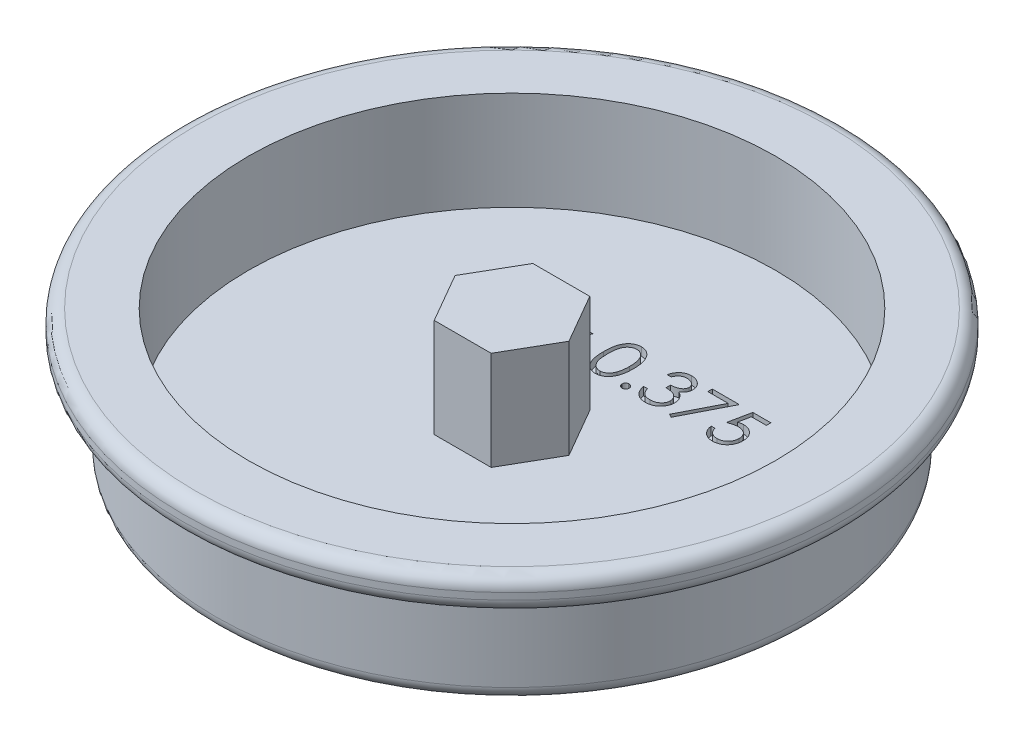
from build123d import *

# Parameters (mm, degrees)
BOSS_EXTRUDE1_DEPTH = 9.525
CUT_EXTRUDE1_DEPTH  = 0.79375


with BuildPart() as part:
    # Sketch1 → Revolve1 (revolve)
    with BuildSketch(Plane.XY):
        with BuildLine():
            Line((0, 0), (27.305, 0))
            ThreePointArc((27.305, 0), (28.203025612, 0.371974388), (28.575, 1.27))
            Line((28.575, 1.27), (28.575, 8.255))
            ThreePointArc((28.575, 8.255), (28.946974388, 9.153025612), (29.845, 9.525))
            Line((29.845, 9.525), (30.48, 9.525))
            ThreePointArc((30.48, 9.525), (31.378025612, 9.896974388), (31.75, 10.795))
            Line((31.75, 10.795), (31.75, 11.43))
            ThreePointArc((31.75, 11.43), (31.378025612, 12.328025612), (30.48, 12.7))
            Line((30.48, 12.7), (25.4, 12.7))
            Line((25.4, 12.7), (25.4, 3.175))
            Line((25.4, 3.175), (0, 3.175))
            Line((0, 3.175), (0, 0))
        make_face()
    revolve(axis=Axis((0, 3.175, 0), (0, -1, 0)))

    # Sketch2 → Boss-Extrude1 (add)
    with BuildSketch(Plane(origin=(0, 3.175, 0), x_dir=(1, 0, 0), z_dir=(0, 1, 0))):
        Polygon((2.742298309, 4.7498), (-2.742298309, 4.7498), (-5.484596617, 0), (-2.742298309, -4.7498), (2.742298309, -4.7498), (5.484596617, 0), align=None)
    extrude(amount=BOSS_EXTRUDE1_DEPTH)

    # Sketch3 → Cut-Extrude1 (cut)
    # profile 1 of 7: a face of its own
    with BuildSketch(Plane(origin=(0, 3.175, 0), x_dir=(1, 0, 0), z_dir=(0, 1, 0))):
        with BuildLine():
            Line((-10.301940322, 11.144696079), (-10.681854852, 11.144696079))
            add(Edge.make_bspline(
                [(-10.681854852, 11.144696079), (-10.679378771, 11.195098009), (-10.674515815, 11.29408606), (-10.651742551, 11.438411166), (-10.619156919, 11.576363161), (-10.573084398, 11.70683439), (-10.515866329, 11.830978471), (-10.44725001, 11.9483023), (-10.365977448, 12.058358309), (-10.273803589, 12.160126243), (-10.173692949, 12.253486448), (-10.065675289, 12.334107551), (-9.952167494, 12.402225116), (-9.833513935, 12.459170999), (-9.70837592, 12.501915384), (-9.577889035, 12.533631081), (-9.441479985, 12.552712947), (-9.348540148, 12.55476404), (-9.301272587, 12.55580719)],
                knots=[0, 0, 0, 0, 1.10065271, 2.161652631, 3.183658789, 4.190468796, 5.17591951, 6.163126047, 7.15150782, 8.156236427, 9.156009102, 10.134482811, 11.092018607, 12.041330605, 13.001268258, 13.972401359, 14.968799086, 16, 16, 16, 16], degree=3))
            add(Edge.make_bspline(
                [(-9.301272587, 12.55580719), (-9.254853392, 12.554720485), (-9.163641333, 12.55258515), (-9.030518706, 12.534247524), (-8.903788074, 12.505526665), (-8.783697156, 12.465230876), (-8.671204107, 12.411063045), (-8.565463853, 12.345993641), (-8.465217539, 12.270737274), (-8.374978858, 12.182135042), (-8.292116705, 12.087547396), (-8.22063112, 11.986566789), (-8.159413294, 11.882270415), (-8.108386291, 11.773862971), (-8.070823151, 11.660323727), (-8.042304747, 11.543305682), (-8.026184923, 11.421597577), (-8.023710934, 11.339221076), (-8.022453142, 11.297340309)],
                knots=[0, 0, 0, 0, 1.111607364, 2.184268762, 3.212621178, 4.221274766, 5.211760367, 6.196651075, 7.1921475, 8.207485113, 9.220403448, 10.201281604, 11.166441695, 12.114753415, 13.065576456, 14.026450734, 14.996634279, 16, 16, 16, 16], degree=3))
            add(Edge.make_bspline(
                [(-8.022453142, 11.297340309), (-8.024501184, 11.238378643), (-8.028561327, 11.121490003), (-8.063292049, 10.949719646), (-8.117534972, 10.783297129), (-8.182846061, 10.649357726), (-8.248731779, 10.54142769), (-8.308104288, 10.452565542), (-8.377609345, 10.356885595), (-8.458258576, 10.254708244), (-8.548383669, 10.145233149), (-8.648800952, 10.028526444), (-8.760226497, 9.905793923), (-8.838432494, 9.821967148), (-8.878956881, 9.778530213)],
                knots=[0, 0, 0, 0, 1.184426356, 2.348067706, 3.509069118, 4.696110526, 5.333549288, 6.050745305, 6.844228056, 7.710549037, 8.667450064, 9.695053472, 10.805634456, 12, 12, 12, 12], degree=3))
            Line((-8.878956881, 9.778530213), (-9.938138238, 8.648114882))
            Line((-9.938138238, 8.648114882), (-7.968179638, 8.648114882))
            Line((-7.968179638, 8.648114882), (-7.968179638, 8.213926848))
            Line((-7.968179638, 8.213926848), (-10.844675364, 8.213926848))
            Line((-10.844675364, 8.213926848), (-9.20290186, 9.965943408))
            add(Edge.make_bspline(
                [(-9.20290186, 9.965943408), (-9.162929654, 10.007669931), (-9.086151227, 10.087818042), (-8.977557063, 10.204830956), (-8.880022286, 10.313385162), (-8.792915535, 10.413275559), (-8.718126438, 10.505963265), (-8.651757167, 10.588446382), (-8.598579738, 10.664349384), (-8.540866831, 10.752330889), (-8.48496992, 10.859751501), (-8.43693688, 10.991025582), (-8.407648444, 11.126162354), (-8.404134976, 11.217483866), (-8.402367672, 11.263419369)],
                knots=[0, 0, 0, 0, 1.329631726, 2.553950428, 3.673215718, 4.687767853, 5.603093632, 6.413772471, 7.123043292, 7.734684054, 8.834405432, 9.900288307, 10.943827018, 12, 12, 12, 12], degree=3))
            add(Edge.make_bspline(
                [(-8.402367672, 11.263419369), (-8.403136617, 11.292304489), (-8.404652061, 11.349231514), (-8.41802661, 11.432695622), (-8.438238365, 11.51320735), (-8.467200724, 11.591014346), (-8.505429829, 11.665334325), (-8.551964298, 11.736257754), (-8.605655137, 11.804824407), (-8.66776572, 11.869114586), (-8.735996796, 11.927995663), (-8.80807746, 11.980155271), (-8.884338062, 12.023745434), (-8.964457067, 12.059478997), (-9.048211111, 12.087510173), (-9.135762184, 12.106933407), (-9.226868375, 12.119128411), (-9.289078412, 12.12077841), (-9.320777127, 12.121619155)],
                knots=[0, 0, 0, 0, 0.991446411, 1.95395049, 2.89581595, 3.838931463, 4.798493298, 5.75982156, 6.748411868, 7.785213223, 8.824556874, 9.840280684, 10.836137867, 11.835679398, 12.848801643, 13.863922112, 14.911575587, 16, 16, 16, 16], degree=3))
            add(Edge.make_bspline(
                [(-9.320777127, 12.121619155), (-9.353882801, 12.120754307), (-9.418896878, 12.119055887), (-9.514351328, 12.107175141), (-9.605411268, 12.086678744), (-9.69230576, 12.058646004), (-9.775181831, 12.023015188), (-9.853636436, 11.978635649), (-9.927493455, 11.925678472), (-9.996891726, 11.865637037), (-10.060831967, 11.798789557), (-10.11701057, 11.72427084), (-10.166097901, 11.64344149), (-10.208926212, 11.556519605), (-10.243706904, 11.462716462), (-10.270283952, 11.362365047), (-10.291313757, 11.255901091), (-10.298339301, 11.182380083), (-10.301940322, 11.144696079)],
                knots=[0, 0, 0, 0, 1.031018746, 2.02475058, 2.990194455, 3.934040569, 4.864654155, 5.795059489, 6.735614925, 7.690564532, 8.649604399, 9.611025574, 10.590972636, 11.591080095, 12.624614302, 13.701020113, 14.821632451, 16, 16, 16, 16], degree=3))
        make_face()
    # profile 2 of 7: a face of its own
    with BuildSketch(Plane(origin=(0, 3.175, 0), x_dir=(1, 0, 0), z_dir=(0, 1, 0))):
        Polygon((-5.96005998, 11.307516591), (-5.508063452, 11.307516591), (-4.711769381, 10.19151766), (-3.915475311, 11.307516591), (-3.463478783, 11.307516591), (-4.485347106, 9.875204893), (-3.30065827, 8.213926848), (-3.752654798, 8.213926848), (-4.711769381, 9.558044102), (-5.670883965, 8.213926848), (-6.122880493, 8.213926848), (-4.937343634, 9.875204893), align=None)
    # profile 3 of 7: a face of its own
    with BuildSketch(Plane(origin=(0, 3.175, 0), x_dir=(1, 0, 0), z_dir=(0, 1, 0))):
        with BuildLine():
            add(Edge.make_bspline(
                [(-1.509632629, 10.328897467), (-1.509235884, 10.396748594), (-1.508465199, 10.528550384), (-1.499891585, 10.720604189), (-1.485649028, 10.900775205), (-1.466130492, 11.069072057), (-1.442377887, 11.225538191), (-1.410669632, 11.369755469), (-1.374610337, 11.502391374), (-1.332818331, 11.623878423), (-1.285661672, 11.735853359), (-1.234336424, 11.840386698), (-1.176805672, 11.937320273), (-1.116357406, 12.028201219), (-1.05054471, 12.111541879), (-0.981240459, 12.188519194), (-0.905739713, 12.257354102), (-0.826609027, 12.320063439), (-0.74313197, 12.375035657), (-0.657687983, 12.423456208), (-0.56968895, 12.464821762), (-0.478894615, 12.497346384), (-0.386121045, 12.524210932), (-0.291043926, 12.542582326), (-0.193506276, 12.554141634), (-0.12767016, 12.555246737), (-0.094281401, 12.55580719)],
                knots=[0, 0, 0, 0, 1.646270934, 3.197905019, 4.663502075, 6.030701355, 7.308322542, 8.50163776, 9.611534131, 10.641858119, 11.616356847, 12.558055219, 13.465016945, 14.349605745, 15.204443733, 16.039544428, 16.859896111, 17.680448484, 18.487036065, 19.28249412, 20.06191084, 20.843045899, 21.620316918, 22.403196591, 23.190181807, 24, 24, 24, 24], degree=3))
            add(Edge.make_bspline(
                [(-0.094281401, 12.55580719), (-0.060613727, 12.555217166), (0.006340684, 12.554043793), (0.105328566, 12.542766263), (0.20202961, 12.524053571), (0.296031549, 12.49753963), (0.388106533, 12.464645812), (0.477534378, 12.423416632), (0.564870563, 12.375424097), (0.648727196, 12.319031408), (0.730024874, 12.256157607), (0.806766696, 12.18508276), (0.878959647, 12.106524528), (0.947509779, 12.021323417), (1.010472263, 11.927845266), (1.070432509, 11.827715914), (1.124101543, 11.719184297), (1.17579015, 11.604061255), (1.220405839, 11.479161401), (1.260642155, 11.345188786), (1.293152907, 11.20056096), (1.320233265, 11.046036739), (1.34121233, 10.881048641), (1.356491811, 10.705950335), (1.364563067, 10.520626625), (1.366083077, 10.393919512), (1.366863097, 10.328897467)],
                knots=[0, 0, 0, 0, 0.810914788, 1.612654377, 2.396697861, 3.181598691, 3.963628158, 4.749916497, 5.551656086, 6.361998678, 7.18212741, 8.025565596, 8.878627764, 9.750805457, 10.657531673, 11.591944965, 12.560506719, 13.57287815, 14.630710178, 15.753379473, 16.941251878, 18.199788006, 19.531962791, 20.947069417, 22.433333509, 24, 24, 24, 24], degree=3))
            add(Edge.make_bspline(
                [(1.366863097, 10.328897467), (1.36607499, 10.264159026), (1.364539396, 10.138018814), (1.356582293, 9.953528968), (1.34090852, 9.779359906), (1.321302154, 9.615093918), (1.294147179, 9.461414703), (1.260758073, 9.317790465), (1.223685778, 9.183600969), (1.177923694, 9.05994553), (1.127836454, 8.945099161), (1.073341121, 8.837854134), (1.014957617, 8.737262522), (0.951350278, 8.644129495), (0.88355234, 8.55779531), (0.810112729, 8.4797839), (0.73310164, 8.408215563), (0.651564718, 8.344532166), (0.566400271, 8.288791498), (0.479364054, 8.238942364), (0.388911771, 8.198746628), (0.297093247, 8.164232817), (0.202595128, 8.137864651), (0.105535208, 8.119632464), (0.006407189, 8.106845562), (-0.060602323, 8.105870105), (-0.094281401, 8.105379839)],
                knots=[0, 0, 0, 0, 1.561518951, 3.042555995, 4.452378317, 5.7783523, 7.031515105, 8.214008947, 9.334062868, 10.386615937, 11.391082383, 12.354592575, 13.286541444, 14.194233754, 15.072674879, 15.931287219, 16.775624067, 17.606195743, 18.42308326, 19.229000347, 20.022332153, 20.807536673, 21.593273796, 22.3848459, 23.188221202, 24, 24, 24, 24], degree=3))
            add(Edge.make_bspline(
                [(-0.094281401, 8.105379839), (-0.127669234, 8.105943907), (-0.193503524, 8.107056139), (-0.291054553, 8.118563224), (-0.385739032, 8.137063499), (-0.478024191, 8.162967392), (-0.5683835, 8.194674861), (-0.655585675, 8.235984554), (-0.740600302, 8.283560047), (-0.823200565, 8.337741176), (-0.901834322, 8.399815974), (-0.976944064, 8.468473732), (-1.046642896, 8.545427763), (-1.111514612, 8.629462965), (-1.173168985, 8.71980622), (-1.229882799, 8.817691014), (-1.282340879, 8.922729219), (-1.330290625, 9.035599454), (-1.372803771, 9.157948748), (-1.410356713, 9.291176802), (-1.44000717, 9.436459524), (-1.465386554, 9.592630053), (-1.485856998, 9.760359474), (-1.49983223, 9.939738844), (-1.50846982, 10.130656382), (-1.509237953, 10.261611252), (-1.509632629, 10.328897467)],
                knots=[0, 0, 0, 0, 0.810891512, 1.598919785, 2.382837074, 3.152667961, 3.926044502, 4.706494248, 5.493654104, 6.291793342, 7.103789334, 7.925228297, 8.761435821, 9.622817696, 10.50288917, 11.416980706, 12.369136599, 13.353924996, 14.394355917, 15.514179734, 16.714354668, 17.994756427, 19.357759367, 20.818452758, 22.365282078, 24, 24, 24, 24], degree=3))
        make_face()
        with BuildLine():
            add(Edge.make_bspline(
                [(-1.129718099, 10.330593514), (-1.129573625, 10.27404985), (-1.12929323, 10.164309701), (-1.121968111, 10.004842137), (-1.111989259, 9.856106597), (-1.099118356, 9.717914224), (-1.080004314, 9.59073278), (-1.058587532, 9.473687545), (-1.032524605, 9.367397934), (-1.001687774, 9.271134582), (-0.966564295, 9.183263804), (-0.928215298, 9.101498525), (-0.887018042, 9.024872849), (-0.840912022, 8.954075056), (-0.790698565, 8.888874267), (-0.737511861, 8.828116461), (-0.679366926, 8.773933445), (-0.598929066, 8.708949535), (-0.492737139, 8.641797821), (-0.358939065, 8.583322074), (-0.221454367, 8.54657377), (-0.128138093, 8.541900465), (-0.081561048, 8.539567873)],
                knots=[0, 0, 0, 0, 1.459021318, 2.831673884, 4.118529203, 5.306027144, 6.411944654, 7.436330062, 8.375795394, 9.233974572, 10.042671642, 10.816086306, 11.563610507, 12.285937304, 12.993564865, 13.685989202, 14.367179055, 15.041617293, 16.353048772, 17.594441528, 18.799311195, 20, 20, 20, 20], degree=3))
            add(Edge.make_bspline(
                [(-0.081561048, 8.539567873), (-0.034682721, 8.541500427), (0.058977146, 8.545361545), (0.195815165, 8.582613351), (0.328657491, 8.638819366), (0.432763552, 8.705279682), (0.511966248, 8.768572042), (0.568713464, 8.822534522), (0.620798037, 8.882957333), (0.670197499, 8.948149814), (0.715505143, 9.019357486), (0.756705319, 9.096237934), (0.794301368, 9.179004654), (0.815720881, 9.236783291), (0.826672125, 9.266324017)],
                knots=[0, 0, 0, 0, 1.353760809, 2.704726607, 4.075137775, 5.516104923, 6.260822281, 7.007110065, 7.778089737, 8.566572457, 9.372053459, 10.217411131, 11.088608312, 12, 12, 12, 12], degree=3))
            add(Edge.make_bspline(
                [(0.826672125, 9.266324017), (0.839434739, 9.30409713), (0.86534832, 9.38079275), (0.898745418, 9.499765929), (0.925046996, 9.624592129), (0.948709353, 9.754525365), (0.964860192, 9.890523861), (0.977859928, 10.03216682), (0.985517045, 10.17956104), (0.98646622, 10.279703553), (0.986948567, 10.330593514)],
                knots=[0, 0, 0, 0, 0.884706709, 1.796334032, 2.740027952, 3.714592787, 4.726048262, 5.777819803, 6.87074269, 8, 8, 8, 8], degree=3))
            add(Edge.make_bspline(
                [(0.986948567, 10.330593514), (0.9862831, 10.381475245), (0.984981305, 10.481010787), (0.980005339, 10.626780396), (0.967155872, 10.765231878), (0.952884557, 10.896961688), (0.931842204, 11.021240626), (0.90915419, 11.13910909), (0.878672724, 11.249106844), (0.846112615, 11.352956052), (0.808846708, 11.449476844), (0.76782482, 11.539119233), (0.72401374, 11.622315996), (0.676428364, 11.698838868), (0.625633585, 11.76903061), (0.57028874, 11.831483882), (0.512589165, 11.88813431), (0.431772188, 11.95279856), (0.325969952, 12.018731754), (0.19431855, 12.079408435), (0.057315008, 12.11425275), (-0.035302407, 12.119165458), (-0.081561048, 12.121619155)],
                knots=[0, 0, 0, 0, 1.31362396, 2.569729283, 3.763502607, 4.902122613, 5.988968491, 7.01645872, 7.998833611, 8.933434873, 9.825090667, 10.667526885, 11.477055099, 12.250526234, 12.991942729, 13.710640831, 14.402115721, 15.076753259, 16.378508321, 17.609869233, 18.806226677, 20, 20, 20, 20], degree=3))
            add(Edge.make_bspline(
                [(-0.081561048, 12.121619155), (-0.128382431, 12.119162072), (-0.222110494, 12.11424343), (-0.36053802, 12.079538257), (-0.493228045, 12.019046383), (-0.5987505, 11.952580181), (-0.679623842, 11.889275747), (-0.736571481, 11.83437975), (-0.789967327, 11.774331423), (-0.839155879, 11.708531012), (-0.885225774, 11.637815758), (-0.927536141, 11.561629347), (-0.965657102, 11.479585697), (-1.000835541, 11.39175439), (-1.031766437, 11.295499343), (-1.057280088, 11.189340655), (-1.080850143, 11.0726677), (-1.097535849, 10.944797438), (-1.112369153, 10.806570453), (-1.121901831, 10.657463601), (-1.129317733, 10.497728589), (-1.129581971, 10.387421035), (-1.129718099, 10.330593514)],
                knots=[0, 0, 0, 0, 1.207732386, 2.417664972, 3.655092373, 4.956220595, 5.625982001, 6.301752483, 6.994047911, 7.697131622, 8.419323945, 9.170223765, 9.943494443, 10.752040957, 11.610060368, 12.549350801, 13.567764191, 14.679664412, 15.874934091, 17.154273443, 18.533957287, 20, 20, 20, 20], degree=3))
        make_face(mode=Mode.SUBTRACT)
    # profile 4 of 7: a face of its own
    with BuildSketch(Plane(origin=(0, 3.175, 0), x_dir=(1, 0, 0), z_dir=(0, 1, 0))):
        with BuildLine():
            add(Edge.make_bspline(
                [(2.425196431, 8.865208899), (2.448770306, 8.863808069), (2.494984133, 8.861061905), (2.561797174, 8.842221547), (2.622266906, 8.808767739), (2.676129716, 8.764181331), (2.720527073, 8.710120862), (2.755173099, 8.65013343), (2.773849339, 8.582761027), (2.776575499, 8.53627942), (2.777974208, 8.512431121)],
                knots=[0, 0, 0, 0, 1.020151414, 1.999887582, 2.974338812, 3.990962822, 5.007586832, 5.987933904, 6.967670073, 8, 8, 8, 8], degree=3))
            add(Edge.make_bspline(
                [(2.777974208, 8.512431121), (2.776528101, 8.489155856), (2.773676398, 8.443257374), (2.75521591, 8.376393129), (2.72026303, 8.316368206), (2.676435943, 8.261574191), (2.62225359, 8.216893329), (2.561654214, 8.18372414), (2.495140978, 8.163534793), (2.448796473, 8.160962986), (2.425196431, 8.159653343)],
                knots=[0, 0, 0, 0, 1.009421747, 1.99056486, 2.972319754, 3.999869655, 5.017953583, 5.993804169, 6.978383603, 8, 8, 8, 8], degree=3))
            add(Edge.make_bspline(
                [(2.425196431, 8.159653343), (2.401579383, 8.160915599), (2.355472719, 8.163379853), (2.289207755, 8.184138676), (2.228239326, 8.216582289), (2.174067522, 8.261657504), (2.129873371, 8.316086249), (2.096459813, 8.376806517), (2.076393632, 8.44306597), (2.073754605, 8.489118157), (2.072418653, 8.512431121)],
                knots=[0, 0, 0, 0, 1.022052826, 1.995314843, 2.982371812, 4.00089066, 5.028879526, 6.005146991, 6.990147033, 8, 8, 8, 8], degree=3))
            add(Edge.make_bspline(
                [(2.072418653, 8.512431121), (2.073703287, 8.536318466), (2.076211378, 8.582955575), (2.096501938, 8.64972021), (2.129614119, 8.710400132), (2.174373025, 8.764098853), (2.228226221, 8.809077781), (2.289060679, 8.841813292), (2.355632313, 8.861214553), (2.401606239, 8.863854359), (2.425196431, 8.865208899)],
                knots=[0, 0, 0, 0, 1.032775665, 2.016367738, 2.991239715, 4.008302682, 5.025365648, 6.011011707, 6.979408107, 8, 8, 8, 8], degree=3))
        make_face()
    # profile 5 of 7: a face of its own
    with BuildSketch(Plane(origin=(0, 3.175, 0), x_dir=(1, 0, 0), z_dir=(0, 1, 0))):
        with BuildLine():
            Line((3.863444294, 11.470337104), (3.483529764, 11.470337104))
            add(Edge.make_bspline(
                [(3.483529764, 11.470337104), (3.493822268, 11.512951632), (3.513943272, 11.59625955), (3.555910813, 11.715285475), (3.601629912, 11.827920591), (3.656529115, 11.932055842), (3.716411132, 12.029784039), (3.785018614, 12.118888599), (3.859186279, 12.201635709), (3.94122217, 12.275069816), (4.027253979, 12.341566688), (4.118493948, 12.398263186), (4.2131064, 12.447036209), (4.311746856, 12.48721687), (4.414708988, 12.517485837), (4.521061961, 12.539446926), (4.63108448, 12.553708559), (4.705769661, 12.555100435), (4.743692691, 12.55580719)],
                knots=[0, 0, 0, 0, 1.162005537, 2.271625781, 3.343758855, 4.383309926, 5.390229558, 6.379919256, 7.361854164, 8.333198761, 9.295911338, 10.242430842, 11.177959212, 12.116337295, 13.062827104, 14.020064771, 14.994644689, 16, 16, 16, 16], degree=3))
            add(Edge.make_bspline(
                [(4.743692691, 12.55580719), (4.798947055, 12.554138978), (4.908250526, 12.550838943), (5.068830592, 12.520704339), (5.223682078, 12.473018702), (5.371110025, 12.407131432), (5.508050415, 12.325866777), (5.629893232, 12.229147524), (5.734986954, 12.118839798), (5.82315444, 11.997001363), (5.89218801, 11.866789461), (5.943092481, 11.732774033), (5.974082514, 11.595272982), (5.978098806, 11.502433225), (5.98011096, 11.455920705)],
                knots=[0, 0, 0, 0, 1.083050992, 2.142477498, 3.193116406, 4.255571735, 5.30263384, 6.308962982, 7.297363603, 8.282367274, 9.249857812, 10.179914175, 11.08814088, 12, 12, 12, 12], degree=3))
            add(Edge.make_bspline(
                [(5.98011096, 11.455920705), (5.978703569, 11.411160105), (5.975949523, 11.323570558), (5.952564946, 11.19569789), (5.913211562, 11.075179003), (5.858698611, 10.961506549), (5.788133117, 10.855401267), (5.702652807, 10.756624427), (5.601654349, 10.664737922), (5.525116967, 10.612100083), (5.485713257, 10.585000566)],
                knots=[0, 0, 0, 0, 1.024540389, 2.004866551, 2.965041327, 3.920577974, 4.882998113, 5.874504559, 6.905732034, 8, 8, 8, 8], degree=3))
            add(Edge.make_bspline(
                [(5.485713257, 10.585000566), (5.530745951, 10.563255539), (5.619968742, 10.520172352), (5.741587001, 10.43568015), (5.851989765, 10.338124378), (5.913559025, 10.261993741), (5.944493973, 10.223742553)],
                knots=[0, 0, 0, 0, 1.015518401, 2.012035669, 3.001164323, 4, 4, 4, 4], degree=3))
            add(Edge.make_bspline(
                [(5.944493973, 10.223742553), (5.964863978, 10.195853653), (6.005270414, 10.140532554), (6.055145774, 10.051588496), (6.100392988, 9.9616586), (6.135650873, 9.868332461), (6.162954502, 9.772691768), (6.182471417, 9.674572299), (6.194595854, 9.573893929), (6.196332189, 9.505782643), (6.197204978, 9.471545705)],
                knots=[0, 0, 0, 0, 1.025084078, 2.033381695, 3.024893161, 4.013698104, 4.991890475, 5.976764909, 6.982997093, 8, 8, 8, 8], degree=3))
            add(Edge.make_bspline(
                [(6.197204978, 9.471545705), (6.195034471, 9.41226728), (6.190703671, 9.293989396), (6.151993982, 9.11924378), (6.091985586, 8.948428173), (6.006766244, 8.785051938), (5.902907448, 8.632191859), (5.779345732, 8.49542337), (5.637485028, 8.377859344), (5.479272482, 8.27963364), (5.30786224, 8.201113867), (5.124527953, 8.146615817), (4.931911221, 8.111121132), (4.799822395, 8.107314919), (4.732668386, 8.105379839)],
                knots=[0, 0, 0, 0, 0.955779014, 1.907060117, 2.875433937, 3.871313158, 4.872415639, 5.851225146, 6.836215519, 7.83643374, 8.849228613, 9.86973379, 10.916971861, 12, 12, 12, 12], degree=3))
            add(Edge.make_bspline(
                [(4.732668386, 8.105379839), (4.687408851, 8.106429964), (4.598353179, 8.108496259), (4.467430091, 8.122621805), (4.342460035, 8.148420954), (4.223274045, 8.183138286), (4.10976624, 8.227154964), (4.002282988, 8.281969008), (3.900163022, 8.346450539), (3.804370005, 8.421360688), (3.714915356, 8.505158118), (3.634176347, 8.599330445), (3.560806883, 8.702136829), (3.496771501, 8.814771382), (3.439153473, 8.935778503), (3.391763173, 9.066707639), (3.350052056, 9.206388313), (3.3306592, 9.303728056), (3.320709251, 9.353670437)],
                knots=[0, 0, 0, 0, 1.048658725, 2.063410685, 3.046034179, 4.001477787, 4.936774919, 5.862367409, 6.792675028, 7.730719943, 8.675894397, 9.627829632, 10.600096036, 11.597688215, 12.626045268, 13.701542398, 14.82072376, 16, 16, 16, 16], degree=3))
            Line((3.320709251, 9.353670437), (3.700623781, 9.353670437))
            add(Edge.make_bspline(
                [(3.700623781, 9.353670437), (3.710521667, 9.321074964), (3.729773914, 9.257673938), (3.762545113, 9.166427092), (3.799881023, 9.08277878), (3.83993387, 9.006115385), (3.881999229, 8.935681907), (3.929067757, 8.87334079), (3.977653295, 8.816353831), (4.014276893, 8.784247491), (4.032200971, 8.76853422)],
                knots=[0, 0, 0, 0, 1.198163088, 2.33053128, 3.407730985, 4.417276592, 5.372219308, 6.28897303, 7.162600585, 8, 8, 8, 8], degree=3))
            add(Edge.make_bspline(
                [(4.032200971, 8.76853422), (4.055903497, 8.75026033), (4.103235384, 8.713768958), (4.180364578, 8.667200322), (4.261481155, 8.626849367), (4.348342713, 8.596026231), (4.439074864, 8.569927536), (4.535144153, 8.552848432), (4.635703016, 8.541130358), (4.704364978, 8.540096298), (4.739452574, 8.539567873)],
                knots=[0, 0, 0, 0, 0.946170439, 1.889420265, 2.845303464, 3.807233317, 4.801018734, 5.828864929, 6.890507805, 8, 8, 8, 8], degree=3))
            add(Edge.make_bspline(
                [(4.739452574, 8.539567873), (4.779068715, 8.540312825), (4.856534659, 8.541769515), (4.969570537, 8.555165846), (5.077106211, 8.574675965), (5.17794775, 8.604808811), (5.273416078, 8.642038984), (5.362172931, 8.68878515), (5.445383459, 8.743630671), (5.521981883, 8.80596851), (5.59085883, 8.874211652), (5.651503765, 8.945589367), (5.703059308, 9.019800703), (5.744647064, 9.097256335), (5.777486301, 9.177635517), (5.799842173, 9.261163815), (5.815386386, 9.347157651), (5.816652289, 9.40561269), (5.817290448, 9.435080694)],
                knots=[0, 0, 0, 0, 1.217147791, 2.380027433, 3.494444702, 4.572153297, 5.609568379, 6.639424714, 7.649109417, 8.668170816, 9.669597737, 10.625200337, 11.543417969, 12.441394052, 13.322311151, 14.205496177, 15.095365482, 16, 16, 16, 16], degree=3))
            add(Edge.make_bspline(
                [(5.817290448, 9.435080694), (5.815439511, 9.474524885), (5.811746849, 9.553216998), (5.783554567, 9.668989683), (5.737182798, 9.780536096), (5.672264618, 9.885953099), (5.593239499, 9.983653475), (5.500874326, 10.070825649), (5.394402087, 10.14275614), (5.296406627, 10.192453848), (5.209604961, 10.226365358), (5.135321592, 10.248953173), (5.052158843, 10.268080166), (4.961122402, 10.285875008), (4.861526321, 10.301019877), (4.753479029, 10.313649502), (4.636958632, 10.323755123), (4.556294079, 10.328267971), (4.514726345, 10.330593514)],
                knots=[0, 0, 0, 0, 1.07054697, 2.135767047, 3.216561865, 4.33974944, 5.486079747, 6.621378074, 7.775625952, 8.963672916, 9.598146892, 10.304877434, 11.070270905, 11.915000392, 12.823868403, 13.805723172, 14.86925407, 16, 16, 16, 16], degree=3))
            Line((4.514726345, 10.330593514), (4.514726345, 10.764781549))
            add(Edge.make_bspline(
                [(4.514726345, 10.764781549), (4.567100136, 10.765670311), (4.669687527, 10.767411179), (4.819540638, 10.788466582), (4.96283693, 10.817592675), (5.096400704, 10.862206193), (5.218137719, 10.914022552), (5.323752856, 10.974319987), (5.411766454, 11.041345445), (5.481750797, 11.116133458), (5.534400436, 11.196343087), (5.572895705, 11.27994133), (5.595635147, 11.367660909), (5.598670649, 11.427525888), (5.600196431, 11.457616752)],
                knots=[0, 0, 0, 0, 1.321986639, 2.589447074, 3.816329219, 5.01088745, 6.139805852, 7.153945165, 8.075214402, 8.924034688, 9.728124013, 10.488707548, 11.240355623, 12, 12, 12, 12], degree=3))
            add(Edge.make_bspline(
                [(5.600196431, 11.457616752), (5.599695191, 11.47972412), (5.598697998, 11.52370568), (5.586122243, 11.587961715), (5.567224593, 11.650253335), (5.541244349, 11.710315639), (5.506470299, 11.767732066), (5.464855439, 11.822992123), (5.415303546, 11.875780313), (5.358521911, 11.924984128), (5.297547632, 11.971876443), (5.230721714, 12.011686271), (5.160059065, 12.045728394), (5.085481454, 12.073800839), (5.00674686, 12.094918264), (4.924225214, 12.110080662), (4.837759159, 12.119560492), (4.778768588, 12.120925338), (4.748780832, 12.121619155)],
                knots=[0, 0, 0, 0, 0.884392785, 1.759457502, 2.611959086, 3.489218968, 4.37281399, 5.2945488, 6.255912374, 7.266815255, 8.301784654, 9.332968512, 10.37626691, 11.440494194, 12.520033166, 13.637162961, 14.798855837, 16, 16, 16, 16], degree=3))
            add(Edge.make_bspline(
                [(4.748780832, 12.121619155), (4.700579291, 12.11993627), (4.60643047, 12.116649203), (4.470703856, 12.087858892), (4.344527138, 12.041923495), (4.248081322, 11.987092129), (4.176861447, 11.932965414), (4.125968388, 11.885694337), (4.075990247, 11.833161303), (4.030215, 11.772130696), (3.983921714, 11.706735626), (3.941776387, 11.633651745), (3.900822283, 11.554785478), (3.876144913, 11.49903171), (3.863444294, 11.470337104)],
                knots=[0, 0, 0, 0, 1.472543308, 2.876219568, 4.221790263, 5.565193594, 6.249813518, 6.953379497, 7.687249741, 8.463570142, 9.283606569, 10.136032583, 11.040678096, 12, 12, 12, 12], degree=3))
        make_face()
    # profile 6 of 7: a face of its own
    with BuildSketch(Plane(origin=(0, 3.175, 0), x_dir=(1, 0, 0), z_dir=(0, 1, 0))):
        Polygon((6.848487029, 12.447260181), (9.453615234, 12.447260181), (7.228401559, 8.105379839), (6.900216463, 8.286008846), (8.810813418, 12.013072147), (6.848487029, 12.013072147), align=None)
    # profile 7 of 7: a face of its own
    with BuildSketch(Plane(origin=(0, 3.175, 0), x_dir=(1, 0, 0), z_dir=(0, 1, 0))):
        with BuildLine():
            Line((12.492931473, 12.447260181), (12.492931473, 12.013072147))
            Line((12.492931473, 12.013072147), (11.052987563, 12.013072147))
            Line((11.052987563, 12.013072147), (10.82486924, 10.899617286))
            add(Edge.make_bspline(
                [(10.82486924, 10.899617286), (10.869689203, 10.911991043), (10.956520791, 10.935963241), (11.084681766, 10.962579744), (11.206350431, 10.978624615), (11.285302546, 10.980815438), (11.323507061, 10.981875566)],
                knots=[0, 0, 0, 0, 1.100273476, 2.13160584, 3.095893838, 4, 4, 4, 4], degree=3))
            add(Edge.make_bspline(
                [(11.323507061, 10.981875566), (11.370779775, 10.980852386), (11.463729741, 10.97884056), (11.599727324, 10.959522228), (11.729549014, 10.929114903), (11.85292331, 10.886635795), (11.970078452, 10.832316404), (12.07993655, 10.76446219), (12.184146597, 10.685198066), (12.280839068, 10.59406648), (12.368558945, 10.49377081), (12.445685428, 10.385932242), (12.511196371, 10.271598784), (12.563884141, 10.149678048), (12.605956621, 10.021517929), (12.63395951, 9.885769948), (12.652606387, 9.743713651), (12.654689654, 9.646583361), (12.655751986, 9.597053183)],
                knots=[0, 0, 0, 0, 1.052922333, 2.070308379, 3.05430497, 4.020497103, 4.973039431, 5.925935799, 6.892292201, 7.88610001, 8.88166317, 9.857072816, 10.836096531, 11.812156883, 12.81219415, 13.836441305, 14.89672472, 16, 16, 16, 16], degree=3))
            add(Edge.make_bspline(
                [(12.655751986, 9.597053183), (12.654947562, 9.562554879), (12.653349584, 9.494024484), (12.645223292, 9.39225007), (12.629577236, 9.292630262), (12.60857056, 9.195151846), (12.581304969, 9.099999367), (12.548298208, 9.006900471), (12.507904918, 8.916434613), (12.463598397, 8.827745802), (12.4137098, 8.742839036), (12.358339605, 8.663435024), (12.299840392, 8.588342608), (12.236895097, 8.51836714), (12.168918656, 8.453968442), (12.096734315, 8.39476433), (12.020918074, 8.339753578), (11.940296971, 8.29116919), (11.856667492, 8.246461614), (11.768821934, 8.209784574), (11.678759944, 8.176993745), (11.585185285, 8.150856507), (11.488309911, 8.130376179), (11.387974135, 8.116465928), (11.284704182, 8.106334428), (11.214702976, 8.105700206), (11.179343065, 8.105379839)],
                knots=[0, 0, 0, 0, 1.056347294, 2.098418968, 3.122841568, 4.141288669, 5.149314143, 6.15115421, 7.162517403, 8.180376062, 9.185164535, 10.17417709, 11.141909838, 12.097768115, 13.052685741, 14.0056014, 14.954263652, 15.917497458, 16.885230207, 17.854509472, 18.828990115, 19.81800267, 20.826176721, 21.857883937, 22.917946725, 24, 24, 24, 24], degree=3))
            add(Edge.make_bspline(
                [(11.179343065, 8.105379839), (11.137161913, 8.106215424), (11.05417548, 8.107859339), (10.932593461, 8.125056935), (10.815614842, 8.149687577), (10.704181291, 8.186742875), (10.597294144, 8.233173222), (10.49639238, 8.291854686), (10.398897775, 8.358353221), (10.308773693, 8.436827553), (10.225127727, 8.522601759), (10.15025033, 8.615683858), (10.083564957, 8.714537564), (10.026139491, 8.819642951), (9.97715617, 8.930723841), (9.938675184, 9.048196423), (9.907616603, 9.171446904), (9.894477037, 9.256299245), (9.887803268, 9.299396933)],
                knots=[0, 0, 0, 0, 1.0467383, 2.05933395, 3.04377827, 4.011590433, 4.970194871, 5.932262533, 6.905835911, 7.896367577, 8.894135286, 9.877477877, 10.858688626, 11.851381753, 12.8477658, 13.868841284, 14.917554742, 16, 16, 16, 16], degree=3))
            Line((9.887803268, 9.299396933), (10.267717798, 9.299396933))
            add(Edge.make_bspline(
                [(10.267717798, 9.299396933), (10.277065672, 9.259027319), (10.295032805, 9.18143468), (10.334470235, 9.072418676), (10.38268896, 8.975270663), (10.440025649, 8.888705548), (10.508424257, 8.81322038), (10.586474138, 8.745950219), (10.673980431, 8.685262206), (10.771217957, 8.634676573), (10.873801395, 8.591534367), (10.981167449, 8.562806126), (11.090392707, 8.542605998), (11.16426845, 8.540583964), (11.201391676, 8.539567873)],
                knots=[0, 0, 0, 0, 1.136247022, 2.183929868, 3.172523383, 4.106158343, 5.02341133, 5.958108904, 6.928429099, 7.938127109, 8.96079061, 9.975095812, 10.982467395, 12, 12, 12, 12], degree=3))
            add(Edge.make_bspline(
                [(11.201391676, 8.539567873), (11.237627128, 8.540560624), (11.308975029, 8.542515357), (11.413975468, 8.557560639), (11.515349135, 8.580732177), (11.612095748, 8.61540905), (11.705908277, 8.657554566), (11.794413694, 8.711638515), (11.880172412, 8.773880633), (11.960518821, 8.84519008), (12.034105584, 8.923772473), (12.099124892, 9.007807034), (12.153283635, 9.097453125), (12.198923938, 9.191158748), (12.233580785, 9.289950908), (12.258304639, 9.393366615), (12.272822624, 9.501661305), (12.274819766, 9.575526089), (12.275837456, 9.61316563)],
                knots=[0, 0, 0, 0, 1.027316725, 2.022795036, 3.002884548, 3.971462791, 4.93288096, 5.914575861, 6.907176829, 7.935150275, 8.956128384, 9.956726525, 10.942570165, 11.921478529, 12.907843606, 13.90538589, 14.932640048, 16, 16, 16, 16], degree=3))
            add(Edge.make_bspline(
                [(12.275837456, 9.61316563), (12.27504101, 9.64712392), (12.273482079, 9.713592441), (12.260745103, 9.810837195), (12.238590289, 9.902849351), (12.207839501, 9.990073234), (12.168796668, 10.072591112), (12.121085414, 10.150488147), (12.063810351, 10.22273764), (11.998384924, 10.289373396), (11.926710913, 10.350871482), (11.847555148, 10.403297187), (11.762574094, 10.447401164), (11.672791626, 10.485462457), (11.576072177, 10.512798597), (11.474331107, 10.533321658), (11.366469756, 10.545193573), (11.292724257, 10.546840809), (11.254817157, 10.547687532)],
                knots=[0, 0, 0, 0, 1.045622112, 2.046656509, 3.013763289, 3.955457236, 4.890082067, 5.820317437, 6.762574623, 7.722996705, 8.69280354, 9.665887285, 10.63943826, 11.638615906, 12.663482002, 13.728887084, 14.832589034, 16, 16, 16, 16], degree=3))
            add(Edge.make_bspline(
                [(11.254817157, 10.547687532), (11.222004072, 10.546985293), (11.154253375, 10.545535348), (11.050327671, 10.53485949), (10.941117682, 10.517636724), (10.827042054, 10.493946691), (10.707758201, 10.462945294), (10.58351785, 10.425795374), (10.454059775, 10.381379242), (10.36683167, 10.347836469), (10.321991302, 10.330593514)],
                knots=[0, 0, 0, 0, 0.817624296, 1.688186739, 2.600797293, 3.572016777, 4.590301741, 5.671205678, 6.80286297, 8, 8, 8, 8], degree=3))
            Line((10.321991302, 10.330593514), (10.756179336, 12.447260181))
            Line((10.756179336, 12.447260181), (12.492931473, 12.447260181))
        make_face()
    extrude(amount=-CUT_EXTRUDE1_DEPTH, mode=Mode.SUBTRACT)


solid = part.part
